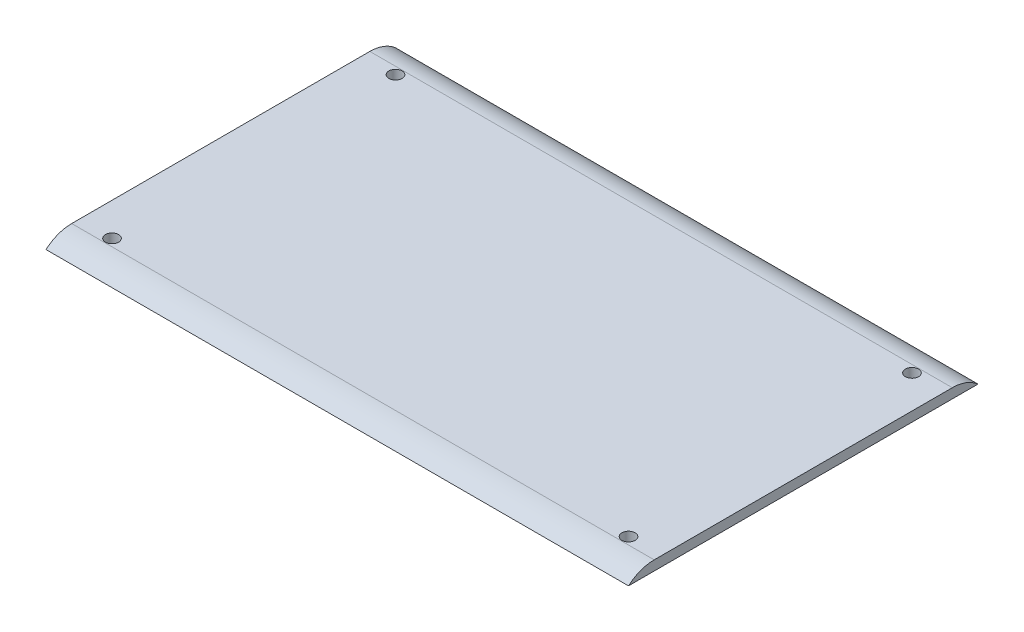
from build123d import *

# Parameters (mm, degrees)
SKETCH1_W           = 150
SKETCH1_H           = 90
BOSS_EXTRUDE1_DEPTH = 2.5
FILLET1_R           = 10
FILLET2_R           = 10
SKETCH2_R           = 1.7
CUT_EXTRUDE1_DEPTH  = 2.5


with BuildPart() as part:
    # Sketch1 → Boss-Extrude1 (new body)
    with BuildSketch(Plane(origin=(0, 0, 0), x_dir=(1, 0, 0), z_dir=(0, 1, 0))):
        with Locations((75, 45)):
            Rectangle(SKETCH1_W, SKETCH1_H)
    extrude(amount=BOSS_EXTRUDE1_DEPTH)

    # Fillet1
    # the kernel refuses this fillet: 10 mm, written as the material it takes off along each edge
    with BuildSketch(Plane(origin=(-16.535945694, 2.5, 0), x_dir=(0, -1, 0), z_dir=(1, 0, 0))) as fillet1_piece_1:
        with BuildLine():
            CenterArc((10, 6.614378278), FILLET1_R, 180, 41.409622109)
            Line((0, 6.614378278), (-0.2, 6.614378278))
            Line((-0.2, 6.614378278), (-0.2, 0))
            Line((-0.2, 0), (0, -0.2))
            ThreePointArc((0, -0.2), (1.25, -0.2), (2.35, -0.132287566))
            Line((2.35, -0.132287566), (2.5, 0))
        make_face()
    extrude(amount=183.071891388, mode=Mode.SUBTRACT)

    # Fillet2
    # the kernel refuses this fillet: 10 mm, written as the material it takes off along each edge
    with BuildSketch(Plane(origin=(166.535945694, 2.5, -90), x_dir=(0, -1, 0), z_dir=(-1, 0, 0))) as fillet2_piece_1:
        with BuildLine():
            CenterArc((10, 6.614378278), FILLET2_R, 180, 41.409622109)
            Line((0, 6.614378278), (-0.2, 6.614378278))
            Line((-0.2, 6.614378278), (-0.2, 0))
            Line((-0.2, 0), (0, -0.2))
            ThreePointArc((0, -0.2), (1.25, -0.2), (2.35, -0.132287566))
            Line((2.35, -0.132287566), (2.5, 0))
        make_face()
    extrude(amount=183.071891388, mode=Mode.SUBTRACT)

    # Sketch2 → Cut-Extrude1 (cut)
    with BuildSketch(Plane(origin=(0, 2.5, 0), x_dir=(1, 0, 0), z_dir=(0, 1, 0))):
        with Locations(Location((8.5, 81.5, 0), (0, 0, 270))):
            Circle(SKETCH2_R)
        with Locations(Location((8.5, 8.5, 0), (0, 0, 270))):
            Circle(SKETCH2_R)
        with Locations(Location((141.5, 81.5, 0), (0, 0, 270))):
            Circle(SKETCH2_R)
        with Locations(Location((141.5, 8.5, 0), (0, 0, 270))):
            Circle(SKETCH2_R)
    extrude(amount=-CUT_EXTRUDE1_DEPTH, mode=Mode.SUBTRACT)


solid = part.part
